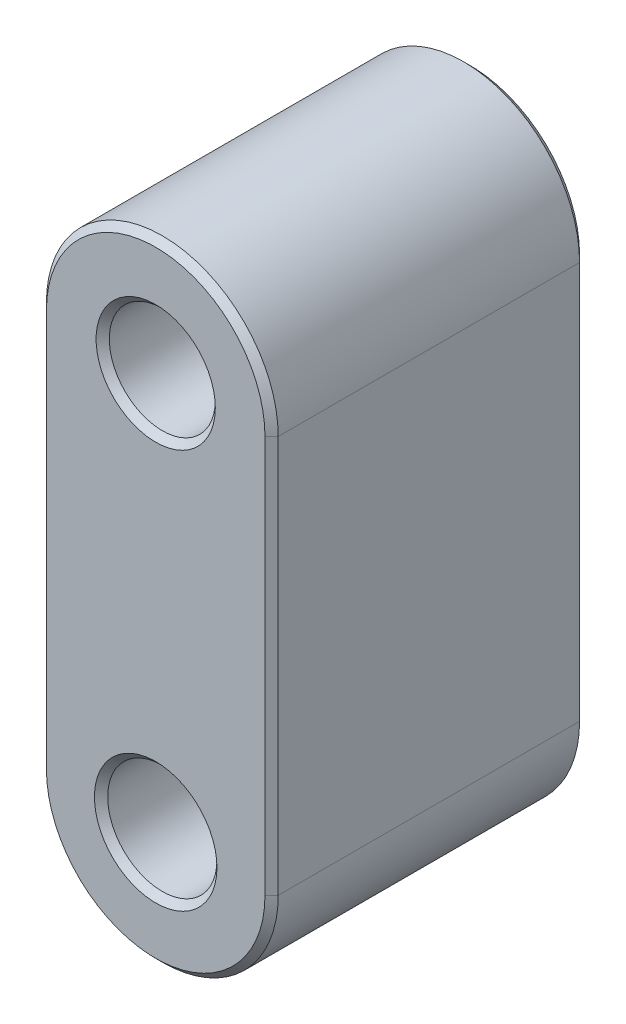
from build123d import *

# Parameters (mm, degrees)
SKETCH1_R             = 1.65
SKETCH1_R_2           = 1.6
BOSS_EXTRUDE1_DEPTH   = 4.75
DEBURS_NO_SPRING_SIZE = 0.2


with BuildPart() as part:
    # Sketch1 → Boss-Extrude1 (new, symmetric)
    with BuildSketch(Plane.XY):
        with BuildLine():
            ThreePointArc((3.5, 0), (0, 3.5), (-3.5, 0))
            Line((-3.5, 0), (-3.5, -12))
            ThreePointArc((-3.5, -12), (0, -15.5), (3.5, -12))
            Line((3.5, -12), (3.5, 0))
        make_face()
        with Locations((0, -12)):
            Circle(SKETCH1_R, mode=Mode.SUBTRACT)
        Circle(SKETCH1_R_2, mode=Mode.SUBTRACT)
    extrude(amount=BOSS_EXTRUDE1_DEPTH, both=True)

    # Deburs no Spring
    deburs_no_spring_edges = [part.edges().sort_by_distance(p)[0] for p in [
        (0, -15.5, -4.75),
        (3.5, -6, -4.75),
        (0, 3.5, -4.75),
        (-3.5, -6, -4.75),
        (-1.65, -12, -4.75),
        (-1.6, 0, -4.75),
        (0, 3.5, 4.75),
        (3.5, -6, 4.75),
        (0, -15.5, 4.75),
        (-3.5, -6, 4.75),
        (-1.65, -12, 4.75),
        (-1.6, 0, 4.75),
    ]]
    chamfer(deburs_no_spring_edges, length=DEBURS_NO_SPRING_SIZE)


solid = part.part
